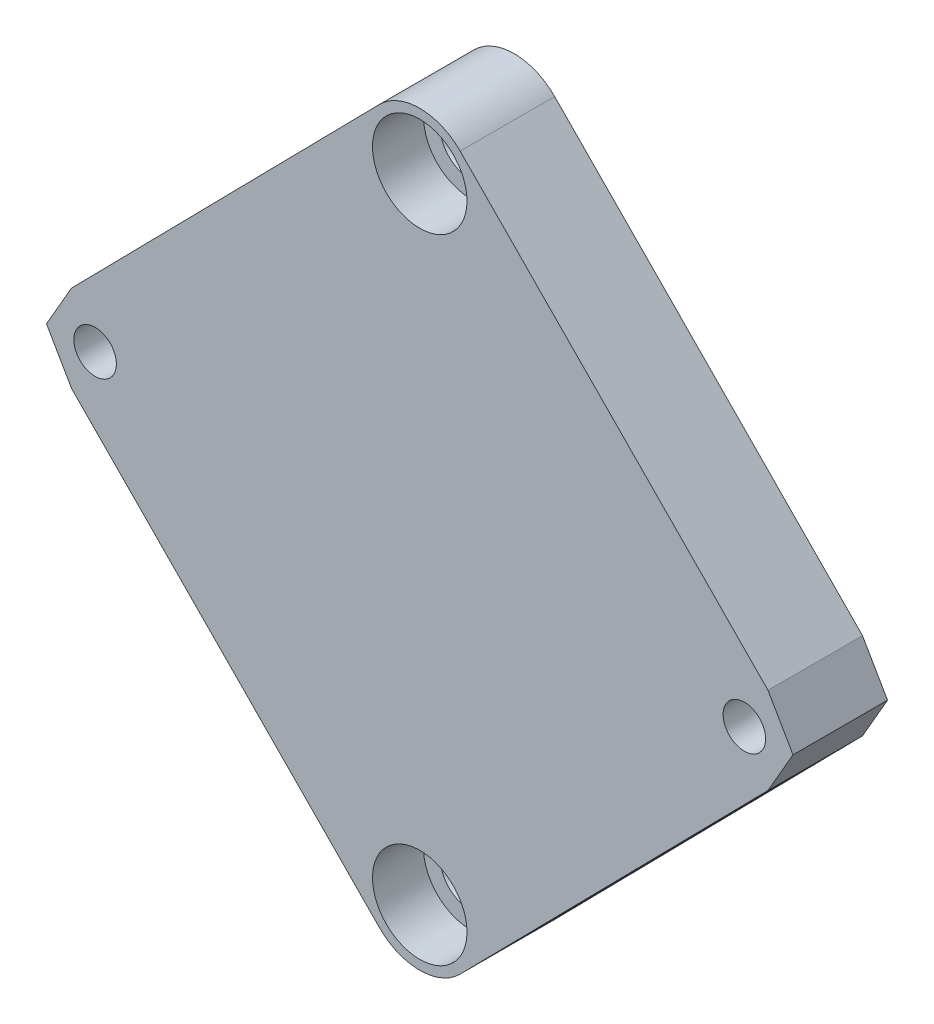
from build123d import *

# Parameters (mm, degrees)
SKETCH1_W                                       = 79
SKETCH1_H                                       = 87
BOSS_EXTRUDE1_DEPTH                             = 10
M4_CLEARANCE_HOLE1_D                            = 4.5
CUT_EXTRUDE3_DEPTH                              = 3.5
CBORE_FOR_M5_SOCKET_HEAD_CAP_SCREW1_D           = 5.5
CBORE_FOR_M5_SOCKET_HEAD_CAP_SCREW1_CBORE_D     = 10
CBORE_FOR_M5_SOCKET_HEAD_CAP_SCREW1_CBORE_DEPTH = 5.4
CUT_EXTRUDE4_DEPTH                              = 10
CHAMFER2_SIZE                                   = 0.5


with BuildPart() as part:
    # Sketch1 → Boss-Extrude1 (new body)
    with BuildSketch(Plane.XY):
        with Locations((39.5, 43.5)):
            Rectangle(SKETCH1_W, SKETCH1_H)
    extrude(amount=BOSS_EXTRUDE1_DEPTH)

    # M4 Clearance Hole1 (through all)
    with Locations(Plane.XY.offset(10)):
        with Locations((5.15, 43.5), (73.85, 43.5)):
            Hole(M4_CLEARANCE_HOLE1_D / 2)

    # Sketch11 → Cut-Extrude3 (cut)
    with BuildSketch(Plane(origin=(0, 0, 0), x_dir=(-1, 0, 0), z_dir=(0, 0, -1))):
        Polygon((-69.635343035, 43.5), (-71.742671517, 47.15), (-75.957328483, 47.15), (-78.064656965, 43.5), (-75.957328483, 39.85), (-71.742671517, 39.85), align=None)
        Polygon((-9.364656965, 43.5), (-7.257328483, 39.85), (-3.042671517, 39.85), (-0.935343035, 43.5), (-3.042671517, 47.15), (-7.257328483, 47.15), align=None)
    extrude(amount=-CUT_EXTRUDE3_DEPTH, mode=Mode.SUBTRACT)

    # CBORE for M5 Socket Head Cap Screw1 (through all)
    with Locations(Plane.XY.offset(10)):
        with Locations((39.5, 77), (39.5, 10)):
            CounterBoreHole(CBORE_FOR_M5_SOCKET_HEAD_CAP_SCREW1_D / 2, CBORE_FOR_M5_SOCKET_HEAD_CAP_SCREW1_CBORE_D / 2, CBORE_FOR_M5_SOCKET_HEAD_CAP_SCREW1_CBORE_DEPTH)

    # Sketch17 → Cut-Extrude4 (cut)
    with BuildSketch(Plane(origin=(0, 0, 0), x_dir=(-1, 0, 0), z_dir=(0, 0, -1))):
        with BuildLine():
            Line((-125.188021535, 43.5), (-108.440250658, 14.492009926))
            Line((-108.440250658, 14.492009926), (-72.295019432, -22.256576081))
            ThreePointArc((-72.295019432, -22.256576081), (-39.5, -36), (-6.704980568, -22.256576081))
            Line((-6.704980568, -22.256576081), (29.440250658, 14.492009926))
            Line((29.440250658, 14.492009926), (46.188021535, 43.5))
            Line((46.188021535, 43.5), (29.440250658, 72.507990074))
            Line((29.440250658, 72.507990074), (-6.704980568, 109.256576081))
            ThreePointArc((-6.704980568, 109.256576081), (-39.5, 123), (-72.295019432, 109.256576081))
            Line((-72.295019432, 109.256576081), (-108.440250658, 72.507990074))
            Line((-108.440250658, 72.507990074), (-125.188021535, 43.5))
        make_face()
        with BuildLine():
            Line((-76.348125386, 48.093181566), (-43.77761123, 81.207379489))
            ThreePointArc((-43.77761123, 81.207379489), (-39.5, 83), (-35.22238877, 81.207379489))
            Line((-35.22238877, 81.207379489), (-2.651874614, 48.093181566))
            Line((-2.651874614, 48.093181566), (0, 43.5))
            Line((0, 43.5), (-2.651874614, 38.906818434))
            Line((-2.651874614, 38.906818434), (-35.22238877, 5.792620511))
            ThreePointArc((-35.22238877, 5.792620511), (-39.5, 4), (-43.77761123, 5.792620511))
            Line((-43.77761123, 5.792620511), (-76.348125386, 38.906818434))
            Line((-76.348125386, 38.906818434), (-79, 43.5))
            Line((-79, 43.5), (-76.348125386, 48.093181566))
        make_face(mode=Mode.SUBTRACT)
    extrude(amount=-CUT_EXTRUDE4_DEPTH, mode=Mode.SUBTRACT)

    # Chamfer2
    chamfer2_edges = [part.edges().sort_by_distance(p)[0] for p in [
        (42.25, 10, 4.6),
        (42.25, 77, 4.6),
    ]]
    chamfer(chamfer2_edges, length=CHAMFER2_SIZE)


solid = part.part
